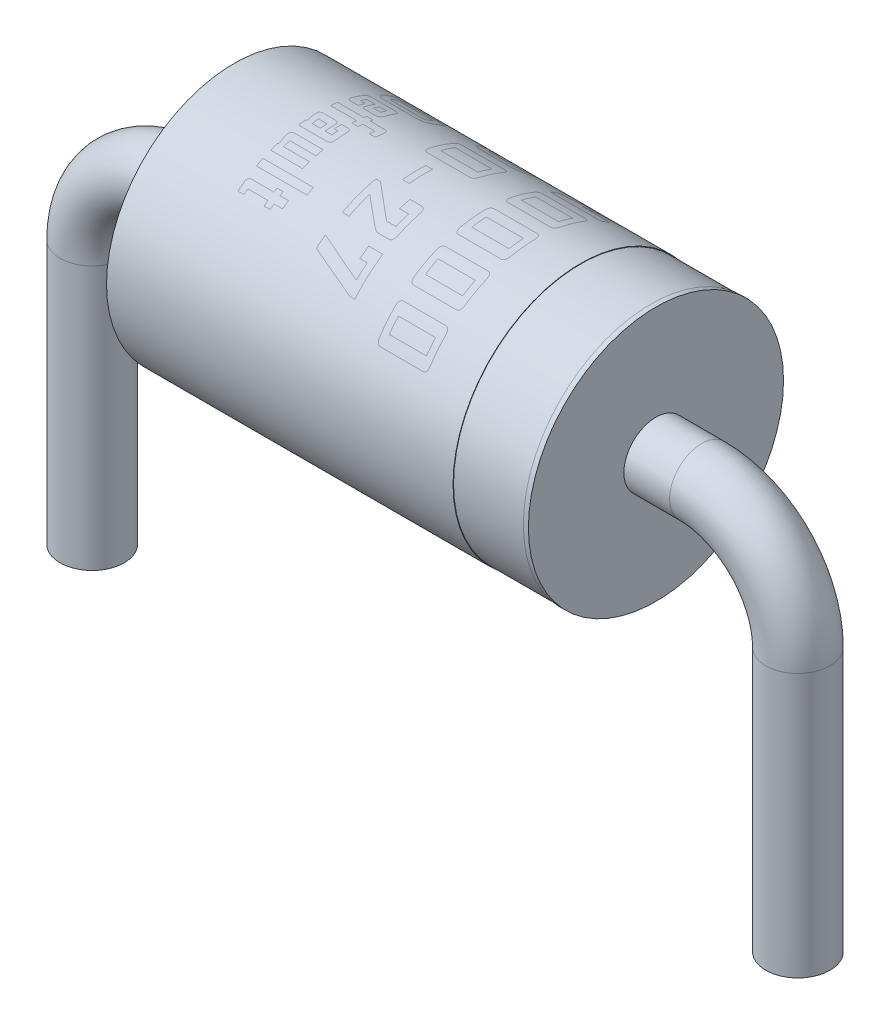
from build123d import *

# Parameters (mm, degrees)
SKETCH1_R     = 2.525
BODY_DEPTH    = 4.175
CATHODE_START = 0.1
SKETCH8_R     = 2.535
SKETCH8_R_2   = 2.515
CATHODE_DEPTH = 1.391666667
SKETCH6_R     = 0.635


with BuildPart() as part:
    # Sketch1 → BODY (new, symmetric)
    with BuildSketch(Plane(origin=(6.985, 0, 0), x_dir=(0, 0, -1), z_dir=(1, 0, 0))):
        with Locations((0, 4.525)):
            Circle(SKETCH1_R)
    extrude(amount=BODY_DEPTH, both=True)

    # Sketch8 → CATHODE (cut)
    with BuildSketch(Plane.ZY.offset(-11.16).offset(CATHODE_START)):
        with Locations((0, 4.525)):
            Circle(SKETCH8_R)
        with Locations((0, 4.525)):
            Circle(SKETCH8_R_2, mode=Mode.SUBTRACT)
    extrude(amount=CATHODE_DEPTH, mode=Mode.SUBTRACT)

    # PINS: sweep along a path in Sketch7
    with BuildLine(Plane.XY) as pins_path:
        Line((0, -2.6), (0, 2.62))
        ThreePointArc((0, 2.62), (0.557961582, 3.967038418), (1.905, 4.525))
        Line((1.905, 4.525), (12.065, 4.525))
        ThreePointArc((12.065, 4.525), (13.412038418, 3.967038418), (13.97, 2.62))
        Line((13.97, 2.62), (13.97, -2.6))
    # Sketch6 → PINS (sweep)
    with BuildSketch(Plane(origin=(6.985, 0, 0), x_dir=(0, 0, -1), z_dir=(1, 0, 0))):
        with Locations((0, 4.525)):
            Circle(SKETCH6_R)
    sweep(path=pins_path.line)


solid = part.part
